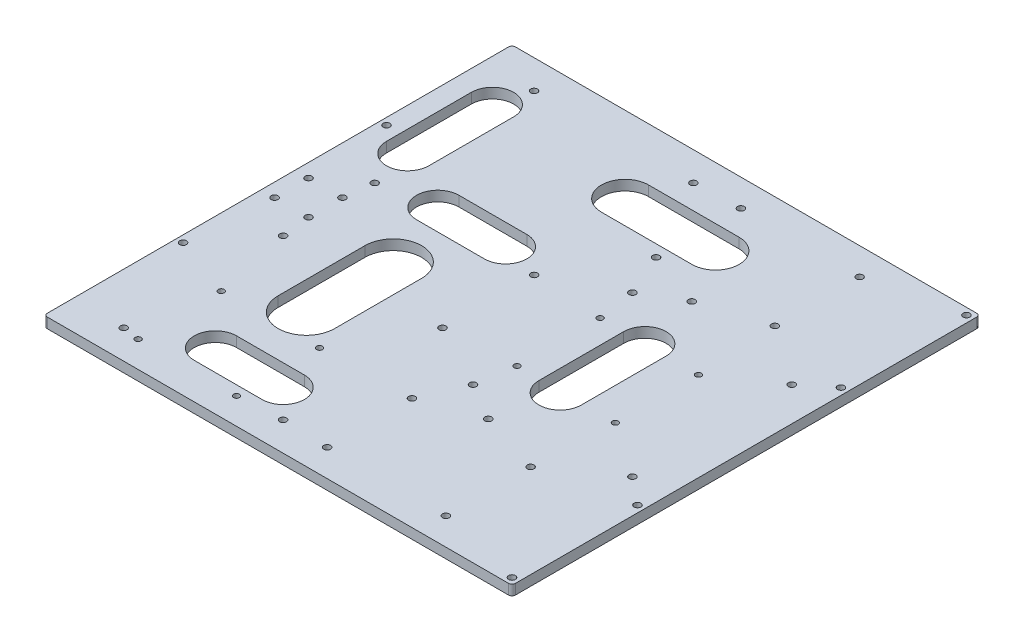
from build123d import *

# Parameters (mm, degrees)
SKETCH_1_W              = 276
SKETCH_1_H              = 276
EXTRUDE_1_DEPTH         = 6
FILLET_1_R              = 2
SKETCH_2_R              = 2
CUT_EXTRUDE_1_DEPTH     = 6
SKETCH_10_R             = 2
CUT_EXTRUDE_1913_DEPTH  = 7
SKETCH_4_R              = 2
CUT_EXTRUDE_94_94_DEPTH = 6
SKETCH_8_R              = 1.75
RPI4_DEPTH              = 6
CUT_EXTRUDE_5_DEPTH     = 6


with BuildPart() as part:
    # Эскиз1 → Бобышка-Вытянуть1 (new body)
    with BuildSketch(Plane(origin=(0, 0, 0), x_dir=(1, 0, 0), z_dir=(0, 1, 0))):
        Rectangle(SKETCH_1_W, SKETCH_1_H)
    extrude(amount=EXTRUDE_1_DEPTH)

    # Скругление1
    fillet_1_edges = [part.edges().sort_by_distance(p)[0] for p in [
        (138, 3, 138),
        (-138, 3, 138),
        (-138, 3, -138),
        (138, 3, -138),
    ]]
    fillet(fillet_1_edges, radius=FILLET_1_R)

    # Эскиз2 → Вырез-Вытянуть1 (cut)
    with BuildSketch(Plane(origin=(0, 6, 0), x_dir=(1, 0, 0), z_dir=(0, 1, 0))):
        with Locations((-134, 60)):
            Circle(SKETCH_2_R)
        with Locations((134, 60)):
            Circle(SKETCH_2_R)
        with Locations((134, -60)):
            Circle(SKETCH_2_R)
        with Locations((-134, -60)):
            Circle(SKETCH_2_R)
        with Locations((46, 60)):
            Circle(SKETCH_2_R)
        with Locations((46, -60)):
            Circle(SKETCH_2_R)
        with Locations((134, 134)):
            Circle(SKETCH_2_R)
        with Locations((134, -134)):
            Circle(SKETCH_2_R)
    extrude(amount=-CUT_EXTRUDE_1_DEPTH, mode=Mode.SUBTRACT)

    # Эскиз10 → Cut-Extrude 1913 (cut)
    with BuildSketch(Plane(origin=(0, 6, 0), x_dir=(1, 0, 0), z_dir=(0, 1, 0))):
        with Locations((13, 122)):
            Circle(SKETCH_10_R)
        with Locations((83, 122)):
            Circle(SKETCH_10_R)
        with Locations((13, 72)):
            Circle(SKETCH_10_R)
        with Locations((83, 72)):
            Circle(SKETCH_10_R)
        with Locations((-130, 10)):
            Circle(SKETCH_10_R)
        with Locations((-110, 10)):
            Circle(SKETCH_10_R)
        with Locations((-110, -10)):
            Circle(SKETCH_10_R)
        with Locations((-130, -10)):
            Circle(SKETCH_10_R)
        with Locations((83, -72)):
            Circle(SKETCH_10_R)
        with Locations((13, -72)):
            Circle(SKETCH_10_R)
        with Locations((83, -122)):
            Circle(SKETCH_10_R)
        with Locations((13, -122)):
            Circle(SKETCH_10_R)
    extrude(amount=-CUT_EXTRUDE_1913_DEPTH, mode=Mode.SUBTRACT)

    # Эскиз4 → 94х94 (cut)
    with BuildSketch(Plane(origin=(0, 6, 0), x_dir=(1, 0, 0), z_dir=(0, 1, 0))):
        with Locations((-108, 121)):
            Circle(SKETCH_4_R)
        with Locations((-14, 121)):
            Circle(SKETCH_4_R)
        with Locations((-14, 27)):
            Circle(SKETCH_4_R)
        with Locations((-108, 27)):
            Circle(SKETCH_4_R)
        with Locations((-108, -27)):
            Circle(SKETCH_4_R)
        with Locations((-14, -27)):
            Circle(SKETCH_4_R)
        with Locations((-14, -121)):
            Circle(SKETCH_4_R)
        with Locations((-108, -121)):
            Circle(SKETCH_4_R)
        with Locations((24, 47)):
            Circle(SKETCH_4_R)
        with Locations((118, 47)):
            Circle(SKETCH_4_R)
        with Locations((118, -47)):
            Circle(SKETCH_4_R)
        with Locations((24, -47)):
            Circle(SKETCH_4_R)
    extrude(amount=-CUT_EXTRUDE_94_94_DEPTH, mode=Mode.SUBTRACT)

    # Эскиз8 → RPi4 (cut)
    with BuildSketch(Plane(origin=(0, 6, 0), x_dir=(1, 0, 0), z_dir=(0, 1, 0))):
        with Locations((85.46549702, 24.5)):
            Circle(SKETCH_8_R)
        with Locations((27.46549702, 24.5)):
            Circle(SKETCH_8_R)
        with Locations((27.46549702, -24.5)):
            Circle(SKETCH_8_R)
        with Locations((85.46549702, -24.5)):
            Circle(SKETCH_8_R)
        with Locations((-40, -73.5)):
            Circle(SKETCH_8_R)
        with Locations((-98, -73.5)):
            Circle(SKETCH_8_R)
        with Locations((-98, -122.5)):
            Circle(SKETCH_8_R)
        with Locations((-40, -122.5)):
            Circle(SKETCH_8_R)
    extrude(amount=-RPI4_DEPTH, mode=Mode.SUBTRACT)

    # Эскиз6 → Вырез-Вытянуть5 (cut)
    with BuildSketch(Plane(origin=(0, 6, 0), x_dir=(1, 0, 0), z_dir=(0, 1, 0))):
        with BuildLine():
            Line((-30.62792666, -91.796358409), (-70.62792666, -91.796358409))
            ThreePointArc((-70.62792666, -91.796358409), (-83.12792666, -104.296358409), (-70.62792666, -116.796358409))
            Line((-70.62792666, -116.796358409), (-30.62792666, -116.796358409))
            ThreePointArc((-30.62792666, -116.796358409), (-18.12792666, -104.296358409), (-30.62792666, -91.796358409))
        make_face()
        with BuildLine():
            Line((-36.854148501, 45.577500198), (-76.854148501, 45.577500198))
            ThreePointArc((-76.854148501, 45.577500198), (-89.354148501, 33.077500198), (-76.854148501, 20.577500198))
            Line((-76.854148501, 20.577500198), (-36.854148501, 20.577500198))
            ThreePointArc((-36.854148501, 20.577500198), (-24.354148501, 33.077500198), (-36.854148501, 45.577500198))
        make_face()
        with BuildLine():
            ThreePointArc((-100.792186218, 101.779020019), (-113.292186218, 114.279020019), (-125.792186218, 101.779020019))
            Line((-125.792186218, 101.779020019), (-125.792186218, 51.779020019))
            ThreePointArc((-125.792186218, 51.779020019), (-113.292186218, 39.279020019), (-100.792186218, 51.779020019))
            Line((-100.792186218, 51.779020019), (-100.792186218, 101.779020019))
        make_face()
        with BuildLine():
            Line((27.18238493, 106.773909834), (-26.207579038, 106.773909834))
            ThreePointArc((-26.207579038, 106.773909834), (-40.115888979, 92.865599892), (-26.207579038, 78.957289951))
            Line((-26.207579038, 78.957289951), (27.18238493, 78.957289951))
            ThreePointArc((27.18238493, 78.957289951), (41.090694872, 92.865599892), (27.18238493, 106.773909834))
        make_face()
        with BuildLine():
            ThreePointArc((-45.432108508, -7.888425697), (-62.147948764, 8.827414559), (-78.86378902, -7.888425697))
            Line((-78.86378902, -7.888425697), (-78.86378902, -59.108123383))
            ThreePointArc((-78.86378902, -59.108123383), (-62.147948764, -75.823963639), (-45.432108508, -59.108123383))
            Line((-45.432108508, -59.108123383), (-45.432108508, -7.888425697))
        make_face()
        with BuildLine():
            ThreePointArc((66.348697743, 24.533398762), (53.848697743, 37.033398762), (41.348697743, 24.533398762))
            Line((41.348697743, 24.533398762), (41.348697743, -25.466601238))
            ThreePointArc((41.348697743, -25.466601238), (53.848697743, -37.966601238), (66.348697743, -25.466601238))
            Line((66.348697743, -25.466601238), (66.348697743, 24.533398762))
        make_face()
    extrude(amount=-CUT_EXTRUDE_5_DEPTH, mode=Mode.SUBTRACT)


solid = part.part
